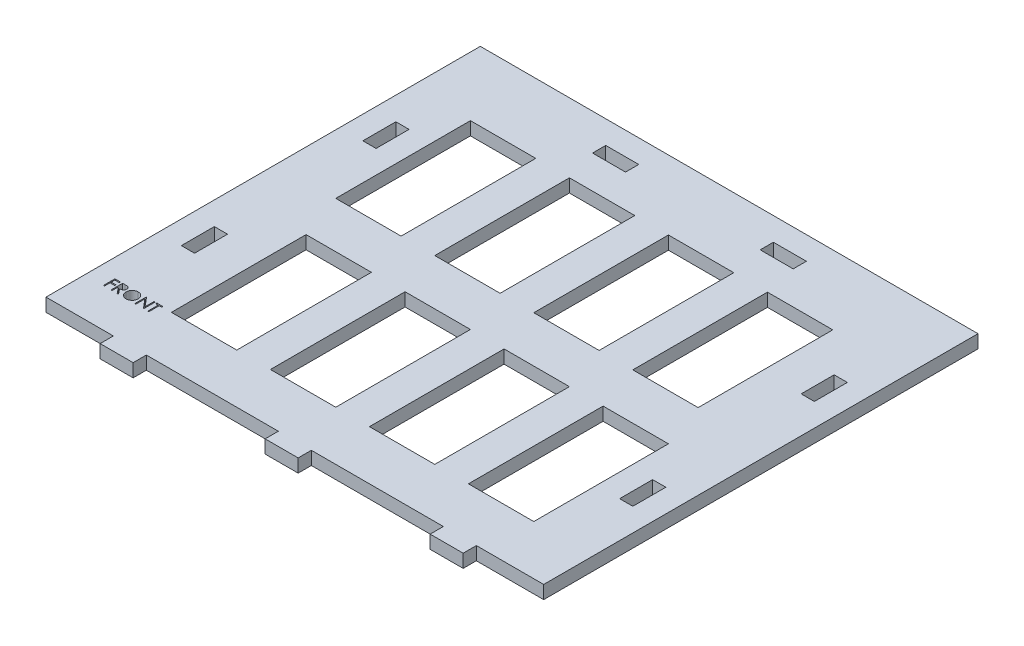
from build123d import *

# Parameters (mm, degrees)
SKETCH1_W           = 150.8
SKETCH1_H           = 131.6
SKETCH1_W_2         = 19.8
SKETCH1_H_2         = 40.8
BOSS_EXTRUDE1_DEPTH = 4
CUT_EXTRUDE1_DEPTH  = 4
CAVITY1_START       = -58.8
CAVITY1_OUTLINE_W   = 10
CAVITY1_OUTLINE_H   = 4
CAVITY1_DEPTH       = 4
CAVITY1_START_2     = -33.210330997
CAVITY1_2_OUTLINE_W = 4
CAVITY1_2_OUTLINE_H = 4
CAVITY1_2_DEPTH     = 10
CAVITY1_START_3     = 21.789669003
CAVITY1_3_OUTLINE_W = 4
CAVITY1_3_OUTLINE_H = 4
CAVITY1_3_DEPTH     = 10
SKETCH3_W           = 10
SKETCH3_H           = 4
BOSS_EXTRUDE2_DEPTH = 4


# Read off the part's stored shape, not the designer's step: Cavity1
with BuildPart() as part:
    # Sketch1 → Boss-Extrude1 (new body)
    with BuildSketch(Plane(origin=(0, 0, 0), x_dir=(1, 0, 0), z_dir=(0, 1, 0))):
        Rectangle(SKETCH1_W, SKETCH1_H)
        with Locations((-42.5, -30.4)):
            Rectangle(SKETCH1_W_2, SKETCH1_H_2, mode=Mode.SUBTRACT)
        with Locations((-12.5, -30.4)):
            Rectangle(SKETCH1_W_2, SKETCH1_H_2, mode=Mode.SUBTRACT)
        with Locations((17.5, -30.4)):
            Rectangle(SKETCH1_W_2, SKETCH1_H_2, mode=Mode.SUBTRACT)
        with Locations((47.5, -30.4)):
            Rectangle(SKETCH1_W_2, SKETCH1_H_2, mode=Mode.SUBTRACT)
        with Locations((-47.5, 24.4)):
            Rectangle(SKETCH1_W_2, SKETCH1_H_2, mode=Mode.SUBTRACT)
        with Locations((-17.5, 24.4)):
            Rectangle(SKETCH1_W_2, SKETCH1_H_2, mode=Mode.SUBTRACT)
        with Locations((12.5, 24.4)):
            Rectangle(SKETCH1_W_2, SKETCH1_H_2, mode=Mode.SUBTRACT)
        with Locations((42.5, 24.4)):
            Rectangle(SKETCH1_W_2, SKETCH1_H_2, mode=Mode.SUBTRACT)
    extrude(amount=BOSS_EXTRUDE1_DEPTH)

    # Sketch2 → Cut-Extrude1 (cut)
    # profile 1 of 5: a face of its own
    with BuildSketch(Plane(origin=(0, 4, 0), x_dir=(1, 0, 0), z_dir=(0, 1, 0))):
        Polygon((-69.755150331, -50.559257417), (-68.050022126, -50.559257417), (-68.050022126, -50.918231776), (-69.441047767, -50.918231776), (-69.441047767, -51.995154853), (-68.050022126, -51.995154853), (-68.050022126, -52.354129212), (-69.441047767, -52.354129212), (-69.441047767, -54.059257417), (-69.755150331, -54.059257417), align=None)
    # profile 2 of 5: a face of its own
    with BuildSketch(Plane(origin=(0, 4, 0), x_dir=(1, 0, 0), z_dir=(0, 1, 0))):
        with BuildLine():
            Line((-67.421816998, -50.559257417), (-66.721396325, -50.559257417))
            add(Edge.make_bspline(
                [(-66.721396325, -50.559257417), (-66.674655196, -50.559413003), (-66.584907052, -50.559711745), (-66.456333782, -50.561377508), (-66.339506685, -50.566151864), (-66.234486845, -50.570260448), (-66.14127619, -50.577752389), (-66.0595889, -50.584913036), (-65.989801202, -50.594286697), (-65.947555351, -50.60299212), (-65.928427575, -50.606933699)],
                knots=[0, 0, 0, 0, 1.410062039, 2.707475311, 3.878576406, 4.937260626, 5.877586885, 6.699081471, 7.410979367, 8, 8, 8, 8], degree=3))
            add(Edge.make_bspline(
                [(-65.928427575, -50.606933699), (-65.902820951, -50.613260465), (-65.852153961, -50.625779028), (-65.779203895, -50.652238629), (-65.709689571, -50.682858254), (-65.643899747, -50.718821974), (-65.582163956, -50.760396754), (-65.523845645, -50.806864876), (-65.468680182, -50.857972082), (-65.418898551, -50.915006923), (-65.3719595, -50.974843433), (-65.332370873, -51.03954719), (-65.298244393, -51.107208717), (-65.271073876, -51.178516135), (-65.249195903, -51.252777907), (-65.233769664, -51.330666704), (-65.224518476, -51.411827679), (-65.22357662, -51.467185588), (-65.223099049, -51.495255013)],
                knots=[0, 0, 0, 0, 1.027469482, 2.033020251, 3.019912614, 3.986113645, 4.951240523, 5.91722682, 6.890402269, 7.87763091, 8.8651537, 9.85103654, 10.82876324, 11.815024772, 12.821070561, 13.842952187, 14.906261191, 16, 16, 16, 16], degree=3))
            add(Edge.make_bspline(
                [(-65.223099049, -51.495255013), (-65.224568047, -51.541890118), (-65.227434443, -51.632887286), (-65.254159547, -51.764948167), (-65.297936067, -51.888137482), (-65.358259356, -52.00230012), (-65.435078831, -52.105210765), (-65.527403622, -52.19560122), (-65.635285234, -52.271241133), (-65.73571455, -52.323693938), (-65.824428749, -52.357286846), (-65.897462062, -52.380923205), (-65.97712904, -52.39918517), (-66.062666374, -52.415545302), (-66.15443003, -52.427896997), (-66.252200069, -52.436943591), (-66.356046221, -52.44259764), (-66.42738529, -52.443439645), (-66.464084626, -52.443872802)],
                knots=[0, 0, 0, 0, 1.260483769, 2.459530307, 3.627416485, 4.787058657, 5.939039949, 7.08810263, 8.267026773, 9.491475466, 10.141966685, 10.831826277, 11.566392101, 12.351337768, 13.187381173, 14.07005841, 15.007169909, 16, 16, 16, 16], degree=3))
            Line((-66.464084626, -52.443872802), (-65.178227254, -54.059257417))
            Line((-65.178227254, -54.059257417), (-65.566648729, -54.059257417))
            Line((-65.566648729, -54.059257417), (-66.8525061, -52.443872802))
            Line((-66.8525061, -52.443872802), (-67.107714434, -52.443872802))
            Line((-67.107714434, -52.443872802), (-67.107714434, -54.059257417))
            Line((-67.107714434, -54.059257417), (-67.421816998, -54.059257417))
            Line((-67.421816998, -54.059257417), (-67.421816998, -50.559257417))
        make_face()
        with BuildLine():
            Line((-67.107714434, -50.918231776), (-67.107714434, -52.084898443))
            Line((-67.107714434, -52.084898443), (-66.466889113, -52.089806295))
            add(Edge.make_bspline(
                [(-66.466889113, -52.089806295), (-66.436969074, -52.089819532), (-66.378975517, -52.089845188), (-66.295074852, -52.085851412), (-66.216954741, -52.081308094), (-66.144913989, -52.074358748), (-66.078920413, -52.065402677), (-66.019007, -52.054199692), (-65.965075948, -52.04114763), (-65.90217741, -52.020946004), (-65.831940878, -51.988939986), (-65.755609418, -51.942374487), (-65.690607081, -51.883805368), (-65.635689218, -51.816831912), (-65.591559787, -51.743195663), (-65.560447733, -51.663779294), (-65.54070529, -51.580587696), (-65.538376745, -51.523409588), (-65.537201613, -51.494553891)],
                knots=[0, 0, 0, 0, 1.146690395, 2.22261258, 3.21895312, 4.145990853, 4.996080663, 5.770904154, 6.481378293, 7.121626537, 8.300444488, 9.431385265, 10.535395872, 11.636531494, 12.74115979, 13.810798291, 14.895190096, 16, 16, 16, 16], degree=3))
            add(Edge.make_bspline(
                [(-65.537201613, -51.494553891), (-65.538403734, -51.466407318), (-65.5407859, -51.410631079), (-65.560234668, -51.328975169), (-65.59312405, -51.251908219), (-65.637446288, -51.179743734), (-65.691445443, -51.114237998), (-65.754763255, -51.058190845), (-65.82566845, -51.01194138), (-65.891939649, -50.982387), (-65.951173861, -50.964267146), (-66.002603521, -50.951515983), (-66.060714999, -50.941271514), (-66.125790458, -50.933063453), (-66.197552088, -50.926008508), (-66.276362739, -50.92125673), (-66.36169952, -50.918442866), (-66.420846451, -50.918303777), (-66.451464434, -50.918231776)],
                knots=[0, 0, 0, 0, 1.101028733, 2.181837193, 3.264309656, 4.369019818, 5.486613113, 6.575447106, 7.666700264, 8.788928104, 9.402425223, 10.0903467, 10.862060571, 11.710948788, 12.657782767, 13.684531032, 14.801375019, 16, 16, 16, 16], degree=3))
            Line((-66.451464434, -50.918231776), (-67.107714434, -50.918231776))
        make_face(mode=Mode.SUBTRACT)
    # profile 3 of 5: a face of its own
    with BuildSketch(Plane(origin=(0, 4, 0), x_dir=(1, 0, 0), z_dir=(0, 1, 0))):
        with BuildLine():
            add(Edge.make_bspline(
                [(-62.822458024, -50.469513827), (-62.757649918, -50.471155307), (-62.630361451, -50.474379308), (-62.443286553, -50.499058411), (-62.264691458, -50.541753801), (-62.093121319, -50.598616784), (-61.930628342, -50.674471169), (-61.77598945, -50.766156317), (-61.629572576, -50.874632776), (-61.493351194, -50.999062003), (-61.368694244, -51.134445457), (-61.258868358, -51.278923367), (-61.166826064, -51.431622169), (-61.091240277, -51.592083), (-61.031941667, -51.759942968), (-60.991022624, -51.936096971), (-60.964884473, -52.119403661), (-60.961828696, -52.244430525), (-60.960278536, -52.307855174)],
                knots=[0, 0, 0, 0, 1.065120563, 2.091984664, 3.0946048, 4.079830382, 5.057816894, 6.036188127, 7.030412546, 8.04752943, 9.064399622, 10.05169764, 11.02544977, 11.989514704, 12.962713494, 13.945757189, 14.957906945, 16, 16, 16, 16], degree=3))
            add(Edge.make_bspline(
                [(-60.960278536, -52.307855174), (-60.961828469, -52.37081262), (-60.964883565, -52.49490904), (-60.991052343, -52.677052485), (-61.032093343, -52.852143181), (-61.090689609, -53.019888834), (-61.165915088, -53.180466398), (-61.258570259, -53.333453351), (-61.367711469, -53.47889985), (-61.491918321, -53.615212515), (-61.627319363, -53.740209986), (-61.772549629, -53.849128861), (-61.924342949, -53.942852986), (-62.084652657, -54.01763666), (-62.251352694, -54.07740858), (-62.425935017, -54.11816121), (-62.607581571, -54.144448254), (-62.731452575, -54.14746677), (-62.794413152, -54.149001007)],
                knots=[0, 0, 0, 0, 1.043624062, 2.057103931, 3.04512605, 4.022047818, 4.998200453, 5.980619268, 6.982898556, 8.009068085, 9.034988726, 10.034168286, 11.015286542, 11.987931943, 12.962482838, 13.94673481, 14.956375938, 16, 16, 16, 16], degree=3))
            add(Edge.make_bspline(
                [(-62.794413152, -54.149001007), (-62.857837471, -54.14745162), (-62.982863687, -54.144397366), (-63.166400722, -54.118215961), (-63.342678466, -54.077274657), (-63.511192817, -54.018765221), (-63.672037747, -53.943147991), (-63.825527829, -53.850943611), (-63.971046977, -53.74153647), (-64.107388723, -53.617369896), (-64.232137921, -53.482198344), (-64.340897297, -53.337364089), (-64.43312241, -53.185708632), (-64.508485743, -53.026811108), (-64.568150202, -52.861439665), (-64.60885502, -52.688491188), (-64.635190972, -52.508951682), (-64.638225819, -52.386708784), (-64.639765716, -52.324682097)],
                knots=[0, 0, 0, 0, 1.053102029, 2.075944431, 3.073151272, 4.055350789, 5.033113405, 6.020478099, 7.024410459, 8.052272461, 9.079885166, 10.07527673, 11.055994387, 12.023226415, 12.992069828, 13.970394897, 14.97016774, 16, 16, 16, 16], degree=3))
            add(Edge.make_bspline(
                [(-64.639765716, -52.324682097), (-64.63923108, -52.283049427), (-64.638168554, -52.200309304), (-64.625376862, -52.077442704), (-64.60681516, -51.956552046), (-64.580213248, -51.837981098), (-64.545421581, -51.722020113), (-64.504369553, -51.607869351), (-64.454229708, -51.496685627), (-64.39754906, -51.387942235), (-64.334287252, -51.283334329), (-64.264411503, -51.184454746), (-64.190376134, -51.090473749), (-64.10921274, -51.003826745), (-64.023596295, -50.921993089), (-63.932137917, -50.846230372), (-63.835395673, -50.775855421), (-63.732953293, -50.71243508), (-63.627335018, -50.655075945), (-63.51845824, -50.605854094), (-63.407801669, -50.563608033), (-63.294847021, -50.529367208), (-63.179894249, -50.502335172), (-63.062692464, -50.483927818), (-62.943335038, -50.4711035), (-62.862923719, -50.470045998), (-62.822458024, -50.469513827)],
                knots=[0, 0, 0, 0, 1.037015668, 2.060948919, 3.074880161, 4.083647147, 5.086022904, 6.090072063, 7.104153813, 8.122640571, 9.144368836, 10.147691507, 11.138137339, 12.123020368, 13.103399296, 14.087645067, 15.080126199, 16.082011238, 17.087798457, 18.072939717, 19.057185487, 20.037253025, 21.01195951, 21.997135196, 22.992090687, 24, 24, 24, 24], degree=3))
        make_face()
        with BuildLine():
            add(Edge.make_bspline(
                [(-62.807033344, -50.828488186), (-62.840247978, -50.828893077), (-62.906359711, -50.829698986), (-63.004644247, -50.840314702), (-63.101636181, -50.855444591), (-63.197355543, -50.877026112), (-63.291401832, -50.906430164), (-63.384651673, -50.940271073), (-63.476254727, -50.981492163), (-63.565908585, -51.028064868), (-63.65282366, -51.079613788), (-63.734836362, -51.136585555), (-63.812159006, -51.19764411), (-63.884602272, -51.262931947), (-63.951953444, -51.332781549), (-64.015538146, -51.406133985), (-64.072807728, -51.485085876), (-64.125293304, -51.567496283), (-64.172261145, -51.653257864), (-64.214026499, -51.741467726), (-64.248190508, -51.832845413), (-64.276052884, -51.926399571), (-64.299152695, -52.02198203), (-64.313786619, -52.120317879), (-64.324518979, -52.220912991), (-64.325278824, -52.288894845), (-64.325663152, -52.323279853)],
                knots=[0, 0, 0, 0, 1.008559885, 2.007477868, 2.99961109, 3.989939068, 4.984837346, 5.991145699, 7.001802488, 8.033829008, 9.059044045, 10.069351652, 11.065060232, 12.050310815, 13.029377138, 14.011219647, 14.996725999, 15.989392538, 16.977580475, 17.965360261, 18.951710183, 19.937753436, 20.929683414, 21.935841486, 22.955955122, 24, 24, 24, 24], degree=3))
            add(Edge.make_bspline(
                [(-64.325663152, -52.323279853), (-64.32438829, -52.373842074), (-64.321880242, -52.473313604), (-64.299922672, -52.619081748), (-64.266100697, -52.759170034), (-64.216243331, -52.892811944), (-64.153892716, -53.021156226), (-64.076865826, -53.143064331), (-63.98560674, -53.258569206), (-63.881943214, -53.366864474), (-63.768620507, -53.465710279), (-63.648287777, -53.552473687), (-63.52223417, -53.625883937), (-63.390130967, -53.68568901), (-63.252683428, -53.733078747), (-63.109005877, -53.765557378), (-62.960055417, -53.786932834), (-62.858524762, -53.78898559), (-62.807033344, -53.790026648)],
                knots=[0, 0, 0, 0, 1.032063989, 2.030389145, 3.003944642, 3.970395727, 4.937377036, 5.913328081, 6.909231446, 7.93887556, 8.970685674, 9.976071282, 10.964166581, 11.944589148, 12.933237628, 13.927779006, 14.949070134, 16, 16, 16, 16], degree=3))
            add(Edge.make_bspline(
                [(-62.807033344, -53.790026648), (-62.772423842, -53.789551144), (-62.703782806, -53.788608076), (-62.601687284, -53.779109399), (-62.501431072, -53.763877529), (-62.403154792, -53.741946874), (-62.306969981, -53.714499667), (-62.212475178, -53.681891939), (-62.120676887, -53.641210736), (-62.030417049, -53.596262784), (-61.944020808, -53.545022627), (-61.861545276, -53.489984477), (-61.785069296, -53.429015856), (-61.712680224, -53.364698044), (-61.645052535, -53.295734196), (-61.582643551, -53.222213974), (-61.525663419, -53.143673317), (-61.473197772, -53.061387911), (-61.42639451, -52.975391658), (-61.38561541, -52.88686198), (-61.351019295, -52.796016871), (-61.32309079, -52.702725299), (-61.301205328, -52.607164451), (-61.286125408, -52.509206373), (-61.27557697, -52.40904703), (-61.274781892, -52.341303174), (-61.2743811, -52.307154052)],
                knots=[0, 0, 0, 0, 1.047197238, 2.076906641, 3.100256066, 4.114471768, 5.12198147, 6.126382909, 7.136867548, 8.15857795, 9.17633901, 10.174870724, 11.156907918, 12.133735059, 13.104061851, 14.077631395, 15.04955518, 16.038496417, 17.029181396, 18.010275684, 18.986308667, 19.968651475, 20.955262928, 21.950658345, 22.966943676, 24, 24, 24, 24], degree=3))
            add(Edge.make_bspline(
                [(-61.2743811, -52.307154052), (-61.274782213, -52.273238547), (-61.275577895, -52.205960897), (-61.28612037, -52.106500079), (-61.30122126, -52.009246867), (-61.322983968, -51.914583064), (-61.351034122, -51.822484539), (-61.385621452, -51.733037792), (-61.426406752, -51.645909597), (-61.473214976, -51.5613153), (-61.525830799, -51.480140562), (-61.583325043, -51.402538149), (-61.646690391, -51.329965408), (-61.714116416, -51.260630714), (-61.787287301, -51.196012824), (-61.865871595, -51.136090303), (-61.948915273, -51.079417029), (-62.036842508, -51.028291467), (-62.127586462, -50.981077235), (-62.22070042, -50.940626232), (-62.31512952, -50.906254112), (-62.410633632, -50.876937147), (-62.50801661, -50.855529117), (-62.606620439, -50.840301067), (-62.706308698, -50.829702681), (-62.773351917, -50.828894303), (-62.807033344, -50.828488186)],
                knots=[0, 0, 0, 0, 1.02996197, 2.043119294, 3.035359645, 4.018872909, 4.991431989, 5.957985074, 6.929999688, 7.912076566, 8.892894881, 9.867085534, 10.843653904, 11.817741046, 12.803660682, 13.806313499, 14.818574707, 15.856120519, 16.894564902, 17.924820532, 18.937903209, 19.946497019, 20.957711757, 21.963978472, 22.977135795, 24, 24, 24, 24], degree=3))
        make_face(mode=Mode.SUBTRACT)
    # profile 4 of 5: a face of its own
    with BuildSketch(Plane(origin=(0, 4, 0), x_dir=(1, 0, 0), z_dir=(0, 1, 0))):
        Polygon((-60.242329818, -54.059257417), (-60.242329818, -50.559257417), (-60.17642437, -50.559257417), (-57.86412469, -53.313964949), (-57.86412469, -50.559257417), (-57.550022126, -50.559257417), (-57.550022126, -54.059257417), (-57.621536549, -54.059257417), (-59.928227254, -51.310859981), (-59.928227254, -54.059257417), align=None)
    # profile 5 of 5: a face of its own
    with BuildSketch(Plane(origin=(0, 4, 0), x_dir=(1, 0, 0), z_dir=(0, 1, 0))):
        Polygon((-57.056432383, -50.918231776), (-57.056432383, -50.559257417), (-55.216688793, -50.559257417), (-55.216688793, -50.918231776), (-55.979509306, -50.918231776), (-55.979509306, -54.059257417), (-56.29361187, -54.059257417), (-56.29361187, -50.918231776), align=None)
    extrude(amount=-CUT_EXTRUDE1_DEPTH, mode=Mode.SUBTRACT)


with BuildPart() as body_2:
    # of the pieces the cut leaves, the one that is kept (cut_extrude1_keep)
    add(part.part.solids().sort_by_distance((-75.4, 0, 65.8))[0])

    # Cavity1 outline → Cavity1 (cut)
    with BuildSketch(Plane.XY.offset(CAVITY1_START)):
        with Locations((25.4, 2)):
            Rectangle(CAVITY1_OUTLINE_W, CAVITY1_OUTLINE_H)
        with Locations((-25.4, 2)):
            Rectangle(CAVITY1_OUTLINE_W, CAVITY1_OUTLINE_H)
    extrude(amount=CAVITY1_DEPTH, mode=Mode.SUBTRACT)

    # Cavity1 2 outline → Cavity1 2 (cut)
    with BuildSketch(Plane.XY.offset(CAVITY1_START_2)):
        with Locations((66.4, 2)):
            Rectangle(CAVITY1_2_OUTLINE_W, CAVITY1_2_OUTLINE_H)
        with Locations((-66.4, 2)):
            Rectangle(CAVITY1_2_OUTLINE_W, CAVITY1_2_OUTLINE_H)
    extrude(amount=CAVITY1_2_DEPTH, mode=Mode.SUBTRACT)

    # Cavity1 3 outline → Cavity1 3 (cut)
    with BuildSketch(Plane.XY.offset(CAVITY1_START_3)):
        with Locations((66.4, 2)):
            Rectangle(CAVITY1_3_OUTLINE_W, CAVITY1_3_OUTLINE_H)
        with Locations((-66.4, 2)):
            Rectangle(CAVITY1_3_OUTLINE_W, CAVITY1_3_OUTLINE_H)
    extrude(amount=CAVITY1_3_DEPTH, mode=Mode.SUBTRACT)

    # Sketch3 → Boss-Extrude2 (add)
    with BuildSketch(Plane.XY.offset(65.8)):
        with Locations((-50, 2)):
            Rectangle(SKETCH3_W, SKETCH3_H)
        with Locations((0, 2)):
            Rectangle(SKETCH3_W, SKETCH3_H)
        with Locations((50, 2)):
            Rectangle(SKETCH3_W, SKETCH3_H)
    extrude(amount=BOSS_EXTRUDE2_DEPTH)


solid = body_2.part
